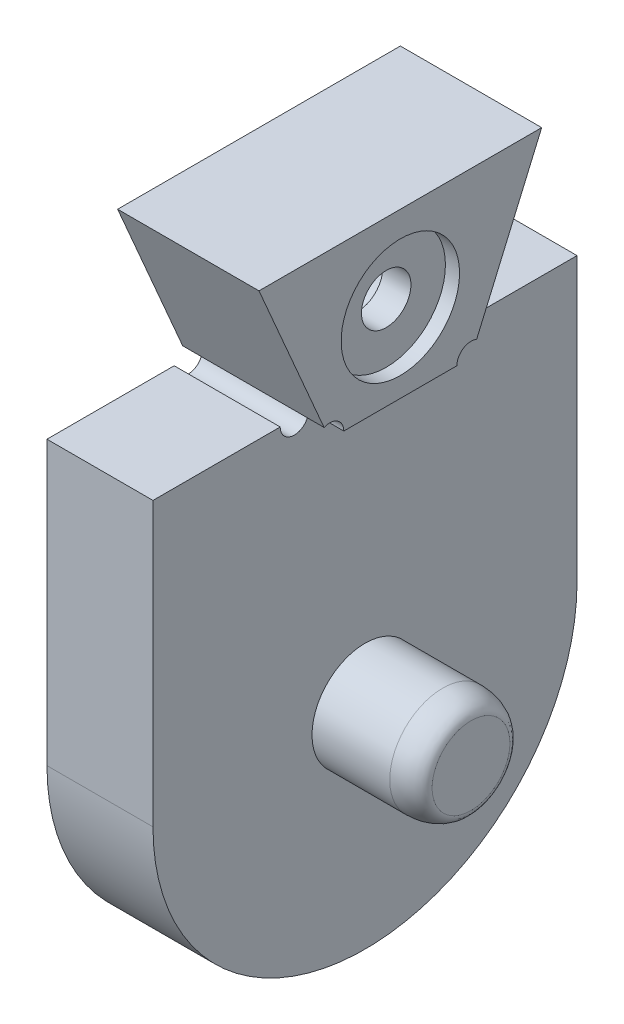
from build123d import *

# Parameters (mm, degrees)
BOSS_EXTRUDE1_DEPTH     = 20.95
BOSS_EXTRUDE2_START     = -9.05
BOSS_EXTRUDE2_DEPTH     = 9.05
SKETCH6_R               = 2
CUT_EXTRUDE2_DEPTH      = 10
CUT_EXTRUDE3_DEPTH      = 2.75
CUT_EXTRUDE4_DEPTH      = 67.499081444
CUT_EXTRUDE4_DEPTH_BACK = 67.499081444
SKETCH8_W               = 8.290514233
SKETCH8_H               = 3.25
SKETCH11_R              = 11.15
BEARING_HOLE_DEPTH      = 7.3
SKETCH9_W               = 12.3
SKETCH9_H               = 21.5
WIRE_HOLE_DEPTH         = 62.274898109
SKETCH12_W              = 46
SKETCH12_H              = 30
BOSS_EXTRUDE3_DEPTH     = 0.0001
BOSS_EXTRUDE4_DEPTH     = 7.5
BOSS_EXTRUDE5_START     = -7.5
BOSS_EXTRUDE5_DEPTH     = 7.5
BOSS_EXTRUDE9_START     = 2.5
BOSS_EXTRUDE9_DEPTH     = 2.5
SKETCH15_R              = 4
CUT_EXTRUDE5_DEPTH      = 77.054456365
SKETCH17_R              = 6.169612062
BOSS_EXTRUDE6_DEPTH     = 10
SKETCH18_R              = 4
KNUB_DEPTH              = 15
SKETCH19_R              = 4.675
CUT_EXTRUDE6_DEPTH      = 2
SKETCH24_R              = 4.5
CUT_EXTRUDE7_DEPTH      = 65.487733972
FILLET1_R               = 0.5
SKETCH25_W              = 8.843315878
SKETCH25_H              = 4.834346013
BOSS_EXTRUDE10_DEPTH    = 2
SKETCH27_W              = 12.3
SKETCH27_H              = 21.5
CUT_EXTRUDE8_DEPTH      = 60.56786481
BOSS_EXTRUDE11_DEPTH    = 14.5901
CUT_EXTRUDE9_REACH      = 69.405
SKETCH29_W              = 15.2
SKETCH29_H              = 3
SKETCH30_W              = 30
SKETCH30_H              = 43.119485767
CUT_EXTRUDE10_DEPTH     = 77.054456365
SKETCH31_W              = 44.37652795
SKETCH31_H              = 54.474735771
CUT_EXTRUDE12_DEPTH     = 64.373176502
SKETCH32_W              = 38.5
SKETCH32_H              = 30
CUT_EXTRUDE13_DEPTH     = 26
SKETCH39_W              = 19.135999949
SKETCH39_H              = 39.276229487
CUT_EXTRUDE18_DEPTH     = 43.013717998
SKETCH33_R              = 2.75
CUT_EXTRUDE14_DEPTH     = 7
SKETCH34_R              = 1.75
CUT_EXTRUDE15_DEPTH     = 10
SKETCH37_R              = 4.188653381
CUT_EXTRUDE17_DEPTH     = 1
SKETCH40_R              = 4
SKETCH40_R_2            = 3.75
CUT_EXTRUDE19_DEPTH     = 7.5
FILLET4_SIZE            = 2
FILLET4_SIZE_2          = 1
CUT_EXTRUDE20_DEPTH     = 44.461586522


with BuildPart() as part:
    # Sketch2 → Boss-Extrude1 (new body)
    with BuildSketch(Plane.XY):
        with BuildLine():
            Line((-14.709485767, 40), (-23, 40))
            Line((-23, 40), (-23, 0))
            Line((-23, 0), (23, 0))
            Line((23, 0), (23, 40))
            Line((23, 40), (14.709485767, 40))
            ThreePointArc((14.709485767, 40), (0, 54.709485767), (-14.709485767, 40))
        make_face()
        with BuildLine():
            Line((-7.65, 18.18111404), (-7.65, 14.59))
            Line((-7.65, 14.59), (7.65, 14.59))
            Line((7.65, 14.59), (7.65, 18.18111404))
            Line((7.65, 18.18111404), (9.45, 18.18111404))
            Line((9.45, 18.18111404), (9.45, 21.20025831))
            ThreePointArc((9.45, 21.20025831), (0, 46.349332344), (-9.45, 21.20025831))
            Line((-9.45, 21.20025831), (-9.45, 18.18111404))
            Line((-9.45, 18.18111404), (-7.65, 18.18111404))
        make_face(mode=Mode.SUBTRACT)
    extrude(amount=BOSS_EXTRUDE1_DEPTH)

    # Sketch3 → Boss-Extrude2 (add)
    with BuildSketch(Plane.XY.offset(BOSS_EXTRUDE2_START)):
        with BuildLine():
            Line((-14.709485767, 40), (-23, 40))
            Line((-23, 40), (-23, 0))
            Line((-23, 0), (23, 0))
            Line((23, 0), (23, 40))
            Line((23, 40), (14.709485767, 40))
            ThreePointArc((14.709485767, 40), (0, 54.709485767), (-14.709485767, 40))
        make_face()
    extrude(amount=BOSS_EXTRUDE2_DEPTH)

    # Sketch6 → Cut-Extrude2 (cut)
    with BuildSketch(Plane.XY.offset(20.95)):
        with Locations((-17.5, 32)):
            Circle(SKETCH6_R)
        with Locations((17.5, 32)):
            Circle(SKETCH6_R)
    extrude(amount=-CUT_EXTRUDE2_DEPTH, mode=Mode.SUBTRACT)

    # Sketch7 → Cut-Extrude3 (cut)
    with BuildSketch(Plane.XY.offset(20.95)):
        with BuildLine():
            Line((-17.5, 35.75), (17.5, 35.75))
            ThreePointArc((17.5, 35.75), (21.25, 32), (17.5, 28.25))
            Line((17.5, 28.25), (-17.5, 28.25))
            ThreePointArc((-17.5, 28.25), (-21.25, 32), (-17.5, 35.75))
        make_face()
    extrude(amount=-CUT_EXTRUDE3_DEPTH, mode=Mode.SUBTRACT)

    # Sketch8 → Cut-Extrude4 (cut, two sides: drawn at the far end of the back side and taken through both)
    with BuildSketch(Plane.XY.offset(20.95).offset(-CUT_EXTRUDE4_DEPTH_BACK)):
        with Locations((-18.854742884, 38.375)):
            Rectangle(SKETCH8_W, SKETCH8_H)
        with Locations((18.854742884, 38.375)):
            Rectangle(SKETCH8_W, SKETCH8_H)
    extrude(amount=CUT_EXTRUDE4_DEPTH + CUT_EXTRUDE4_DEPTH_BACK, mode=Mode.SUBTRACT)

    # Sketch11 → Bearing Hole (cut)
    with BuildSketch(Plane(origin=(0, 0, -9.05), x_dir=(-1, 0, 0), z_dir=(0, 0, -1))):
        with Locations((0, 40)):
            Circle(SKETCH11_R)
    extrude(amount=-BEARING_HOLE_DEPTH, mode=Mode.SUBTRACT)

    # Sketch9 → Wire Hole (cut, through all)
    with BuildSketch(Plane(origin=(0, 14.59, -19.25), x_dir=(-1, 0, 0), z_dir=(0, 1, 0))):
        with Locations((0, 26.95)):
            Rectangle(SKETCH9_W, SKETCH9_H)
    extrude(amount=-WIRE_HOLE_DEPTH, mode=Mode.SUBTRACT)

    # Sketch12 → Boss-Extrude3 (add)
    with BuildSketch(Plane.XZ):
        with Locations((0, 5.95)):
            Rectangle(SKETCH12_W, SKETCH12_H)
    extrude(amount=BOSS_EXTRUDE3_DEPTH)

    # Sketch13 → Boss-Extrude4 (add)
    with BuildSketch(Plane(origin=(23, 0, 0), x_dir=(0, 0, -1), z_dir=(1, 0, 0))):
        with BuildLine():
            Line((-20.95, -0.0001), (-20.95, -20.0001))
            ThreePointArc((-20.95, -20.0001), (-5.95, -35.0001), (9.05, -20.0001))
            Line((9.05, -20.0001), (9.05, -0.0001))
            Line((9.05, -0.0001), (-20.95, -0.0001))
        make_face()
    extrude(amount=-BOSS_EXTRUDE4_DEPTH)

    # Sketch14 → Boss-Extrude5 (add)
    with BuildSketch(Plane.ZY.offset(23).offset(BOSS_EXTRUDE5_START)):
        with BuildLine():
            Line((-9.05, -20.0001), (-9.05, -0.0001))
            Line((-9.05, -0.0001), (20.95, -0.0001))
            Line((20.95, -0.0001), (20.95, -20.0001))
            ThreePointArc((20.95, -20.0001), (5.95, -35.0001), (-9.05, -20.0001))
        make_face()
    extrude(amount=BOSS_EXTRUDE5_DEPTH)

    # Sketch21 → Boss-Extrude9 (add)
    with BuildSketch(Plane(origin=(23, 0, 0), x_dir=(0, 0, -1), z_dir=(1, 0, 0)).offset(BOSS_EXTRUDE9_START)):
        with BuildLine():
            Line((-20.95, -20.0001), (-20.95, 36.75))
            Line((-20.95, 36.75), (9.05, 36.75))
            Line((9.05, 36.75), (9.05, -20.0001))
            ThreePointArc((9.05, -20.0001), (-5.95, -35.0001), (-20.95, -20.0001))
        make_face()
    extrude(amount=-BOSS_EXTRUDE9_DEPTH)

    # Sketch15 → Cut-Extrude5 (cut, through all)
    with BuildSketch(Plane.ZY.offset(23)):
        with Locations(Location((5.95, -20.0001, 0), (0, 0, 270))):
            Circle(SKETCH15_R)
    extrude(amount=-CUT_EXTRUDE5_DEPTH, mode=Mode.SUBTRACT)

    # Sketch17 → Boss-Extrude6 (add)
    with BuildSketch(Plane(origin=(25.5, 0, -23), x_dir=(0, 0, 1), z_dir=(-1, 0, 0))):
        with Locations((28.95, -20.0001)):
            Circle(SKETCH17_R)
        with BuildLine():
            Line((26.765394773, -18.5001), (31.134605227, -18.5001))
            ThreePointArc((31.134605227, -18.5001), (31.6, -20.0001), (31.134605227, -21.5001))
            Line((31.134605227, -21.5001), (26.765394773, -21.5001))
            ThreePointArc((26.765394773, -21.5001), (26.3, -20.0001), (26.765394773, -18.5001))
        make_face(mode=Mode.SUBTRACT)
    extrude(amount=BOSS_EXTRUDE6_DEPTH)

    # Sketch18 → Knub (add)
    with BuildSketch(Plane.ZY.offset(23)):
        with Locations(Location((5.95, -20.0001, 0), (0, 0, 270))):
            Circle(SKETCH18_R)
    extrude(amount=-KNUB_DEPTH)

    # Sketch19 → Cut-Extrude6 (cut)
    with BuildSketch(Plane.ZY.offset(-15.5)):
        with Locations((5.95, -20.0001)):
            Circle(SKETCH19_R)
    extrude(amount=-CUT_EXTRUDE6_DEPTH, mode=Mode.SUBTRACT)

    # Sketch24 → Cut-Extrude7 (cut, through all)
    with BuildSketch(Plane(origin=(0, 0, -1.75), x_dir=(-1, 0, 0), z_dir=(0, 0, -1))):
        with Locations((0, 40)):
            Circle(SKETCH24_R)
    extrude(amount=-CUT_EXTRUDE7_DEPTH, mode=Mode.SUBTRACT)

    # Fillet1
    fillet1_edges = [part.edges().sort_by_distance(p)[0] for p in [
        (11.15, 40, -9.05),
    ]]
    fillet(fillet1_edges, radius=FILLET1_R)

    # Sketch25 → Boss-Extrude10 (add)
    with BuildSketch(Plane(origin=(25.5, 0, 0), x_dir=(0, 0, -1), z_dir=(1, 0, 0))):
        with Locations((-6.185865257, -20.38943492)):
            Rectangle(SKETCH25_W, SKETCH25_H)
    extrude(amount=-BOSS_EXTRUDE10_DEPTH)

    # Sketch27 → Cut-Extrude8 (cut, through all)
    with BuildSketch(Plane(origin=(0, 14.59, 0), x_dir=(1, 0, 0), z_dir=(0, 1, 0))):
        with Locations((0, -7.7)):
            Rectangle(SKETCH27_W, SKETCH27_H)
    extrude(amount=-CUT_EXTRUDE8_DEPTH, mode=Mode.SUBTRACT)

    # Sketch28 → Boss-Extrude11 (add)
    with BuildSketch(Plane.XZ.offset(0.0001)):
        Polygon((-6.15, 7.7), (0, 17.95), (6.15, 7.7), (6.15, 18.45), (-6.15, 18.45), align=None)
    extrude(amount=-BOSS_EXTRUDE11_DEPTH)

    # Cut-Extrude9: up to this face of the body (flat: up to its plane)
    cut_extrude9_end = Plane(part.part.faces().sort_by_distance((0, 29.679084048, 0))[0])
    # Sketch29 → Cut-Extrude9 (cut, up to the picked face)
    with BuildSketch(Plane.XY.offset(20.95), mode=Mode.PRIVATE) as cut_extrude9_sk1:
        with Locations((-0.05, 13.09)):
            Rectangle(SKETCH29_W, SKETCH29_H)
    cut_extrude9_tool1 = split(extrude(cut_extrude9_sk1.sketch, amount=-CUT_EXTRUDE9_REACH, mode=Mode.PRIVATE), bisect_by=cut_extrude9_end, keep=Keep.BOTH, mode=Mode.PRIVATE)
    add(cut_extrude9_tool1.solids().sort_by(Axis((-0.05, 13.09, 20.95), (0, 0, -1)))[0], mode=Mode.SUBTRACT)

    # Sketch30 → Cut-Extrude10 (cut, through all)
    with BuildSketch(Plane.ZY.offset(23)):
        with Locations((5.95, 33.149742884)):
            Rectangle(SKETCH30_W, SKETCH30_H)
    extrude(amount=-CUT_EXTRUDE10_DEPTH, mode=Mode.SUBTRACT)

    # Sketch31 → Cut-Extrude12 (cut, through all)
    with BuildSketch(Plane.ZY.offset(23)):
        with Locations((5.76471192, -10.040592917)):
            Rectangle(SKETCH31_W, SKETCH31_H)
        with BuildLine():
            Line((-4.05, 11.59), (15.95, 11.59))
            Line((15.95, 11.59), (10.95, -0.0001))
            Line((10.95, -0.0001), (20.95, -0.0001))
            Line((20.95, -0.0001), (20.95, -20.0001))
            ThreePointArc((20.95, -20.0001), (5.95, -35.0001), (-9.05, -20.0001))
            Line((-9.05, -20.0001), (-9.05, -0.0001))
            Line((-9.05, -0.0001), (0.95, -0.0001))
            Line((0.95, -0.0001), (-4.05, 11.59))
        make_face(mode=Mode.SUBTRACT)
    extrude(amount=-CUT_EXTRUDE12_DEPTH, mode=Mode.SUBTRACT)

    # Sketch32 → Cut-Extrude13 (cut)
    with BuildSketch(Plane(origin=(0, 11.59, 0), x_dir=(1, 0, 0), z_dir=(0, 1, 0))):
        with Locations((6.25, -5.95)):
            Rectangle(SKETCH32_W, SKETCH32_H)
    extrude(amount=-CUT_EXTRUDE13_DEPTH, mode=Mode.SUBTRACT)


with BuildPart() as cut_extrude13_piece_1:
    # of the separate pieces the step leaves, piece 1, a body of its own (cut_extrude13_pieces)
    add(part.part.solids().sort_by_distance((-23, -0.0001, 0.95))[0])

    # Sketch33 → Cut-Extrude14 (cut)
    with BuildSketch(Plane.ZY.offset(23)):
        with Locations(Location((5.95, 5.59, 0), (0, 0, 270))):
            Circle(SKETCH33_R)
    extrude(amount=-CUT_EXTRUDE14_DEPTH, mode=Mode.SUBTRACT)

    # Sketch34 → Cut-Extrude15 (cut)
    with BuildSketch(Plane.ZY.offset(16)):
        with Locations(Location((5.95, 5.59, 0), (0, 0, 270))):
            Circle(SKETCH34_R)
    extrude(amount=-CUT_EXTRUDE15_DEPTH, mode=Mode.SUBTRACT)

    # Sketch37 → Cut-Extrude17 (cut)
    with BuildSketch(Plane(origin=(-13, 0, 0), x_dir=(0, 0, -1), z_dir=(1, 0, 0))):
        with Locations((-5.95, 5.59)):
            Circle(SKETCH37_R)
    extrude(amount=-CUT_EXTRUDE17_DEPTH, mode=Mode.SUBTRACT)

    # Sketch40 → Cut-Extrude19 (cut)
    with BuildSketch(Plane(origin=(-8, 0, 0), x_dir=(0, 0, -1), z_dir=(1, 0, 0))):
        with Locations((-5.95, -20.0001)):
            Circle(SKETCH40_R)
        with Locations(Location((-5.95, -20.0001, 0), (0, 0, 90))):
            Circle(SKETCH40_R_2, mode=Mode.SUBTRACT)
    extrude(amount=-CUT_EXTRUDE19_DEPTH, mode=Mode.SUBTRACT)

    # Fillet4
    # an asymmetric fillet: 2, 1 mm, written as the material it takes off along each edge
    with BuildSketch(Plane(origin=(-8, -20.0001, 5.95), x_dir=(0, 1, 0), z_dir=(0, 0, -1))) as fillet4_piece_1:
        with BuildLine():
            Bezier((3.75, -FILLET4_SIZE), (3.75, 0), (3.75 - FILLET4_SIZE_2, 0), weights=[1, 0.707106781, 1])
            Line((3.75 - FILLET4_SIZE_2, 0), (3.75, 0))
            Line((3.75, 0), (3.75, -FILLET4_SIZE))
        make_face()
    revolve(axis=Axis((-8, -20.0001, 5.95), (1, 0, 0)), mode=Mode.SUBTRACT)

    # Sketch41 → Cut-Extrude20 (cut, through all)
    with BuildSketch(Plane.ZY.offset(23)):
        with BuildLine():
            Line((0.553885576, 0.918101156), (0.95, -0.0001))
            Line((0.95, -0.0001), (-0.05, -0.0001))
            ThreePointArc((-0.05, -0.0001), (1.785498182, -0.54959321), (0.553885576, 0.918101156))
        make_face()
        with BuildLine():
            Line((11.346114424, 0.918101156), (10.95, -0.0001))
            Line((10.95, -0.0001), (11.95, -0.0001))
            ThreePointArc((11.95, -0.0001), (10.114501818, -0.54959321), (11.346114424, 0.918101156))
        make_face()
    extrude(amount=-CUT_EXTRUDE20_DEPTH, mode=Mode.SUBTRACT)


with BuildPart() as cut_extrude13_piece_2:
    # of the separate pieces the step leaves, piece 2, a body of its own (cut_extrude13_pieces)
    add(part.part.solids().sort_by_distance((25.5, -14.41, -9.05))[0])

    # Sketch39 → Cut-Extrude18 (cut, through all)
    with BuildSketch(Plane(origin=(0, -14.41, 0), x_dir=(1, 0, 0), z_dir=(0, 1, 0))):
        with Locations((22.531610438, -7.15409506)):
            Rectangle(SKETCH39_W, SKETCH39_H)
    extrude(amount=-CUT_EXTRUDE18_DEPTH, mode=Mode.SUBTRACT)


solid = cut_extrude13_piece_1.part
